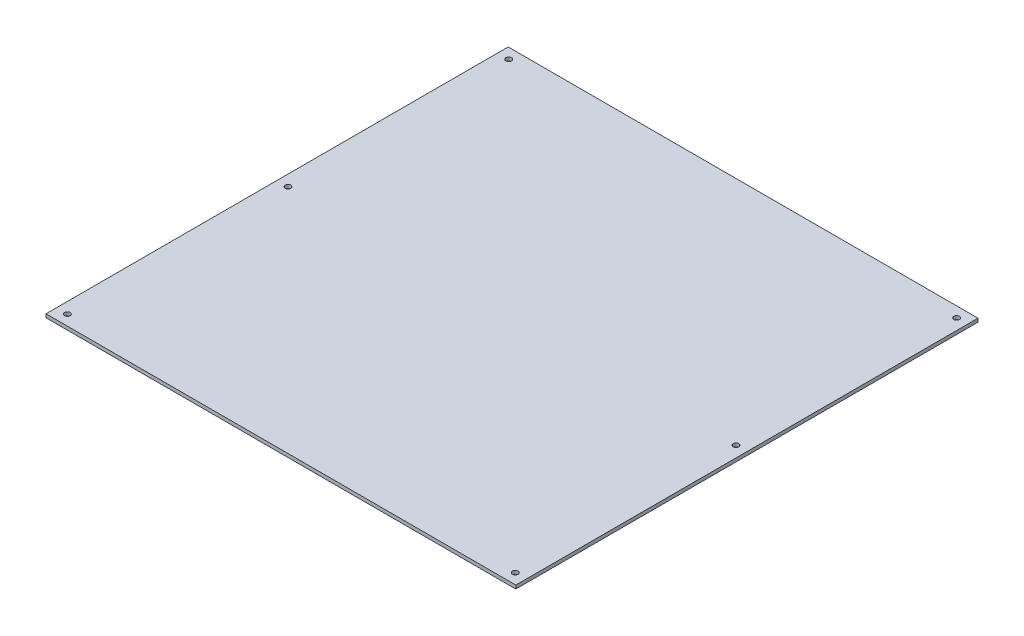
from build123d import *

# Parameters (mm, degrees)
SKETCH2_W           = 429.26
SKETCH2_H           = 422.275
SKETCH2_R           = 2.6
BOSS_EXTRUDE1_DEPTH = 1.5875


with BuildPart() as part:
    # Sketch2 → Boss-Extrude1 (new, symmetric)
    with BuildSketch(Plane(origin=(0, 0, 0), x_dir=(1, 0, 0), z_dir=(0, 1, 0))):
        Rectangle(SKETCH2_W, SKETCH2_H)
        with Locations((-204.63, 201.6125)):
            Circle(SKETCH2_R, mode=Mode.SUBTRACT)
        with Locations((204.63, 201.6125)):
            Circle(SKETCH2_R, mode=Mode.SUBTRACT)
        with Locations((204.63, -201.6125)):
            Circle(SKETCH2_R, mode=Mode.SUBTRACT)
        with Locations((-204.63, -201.6125)):
            Circle(SKETCH2_R, mode=Mode.SUBTRACT)
        with Locations((-204.63, 0)):
            Circle(SKETCH2_R, mode=Mode.SUBTRACT)
        with Locations((204.63, 0)):
            Circle(SKETCH2_R, mode=Mode.SUBTRACT)
    extrude(amount=BOSS_EXTRUDE1_DEPTH, both=True)


solid = part.part
